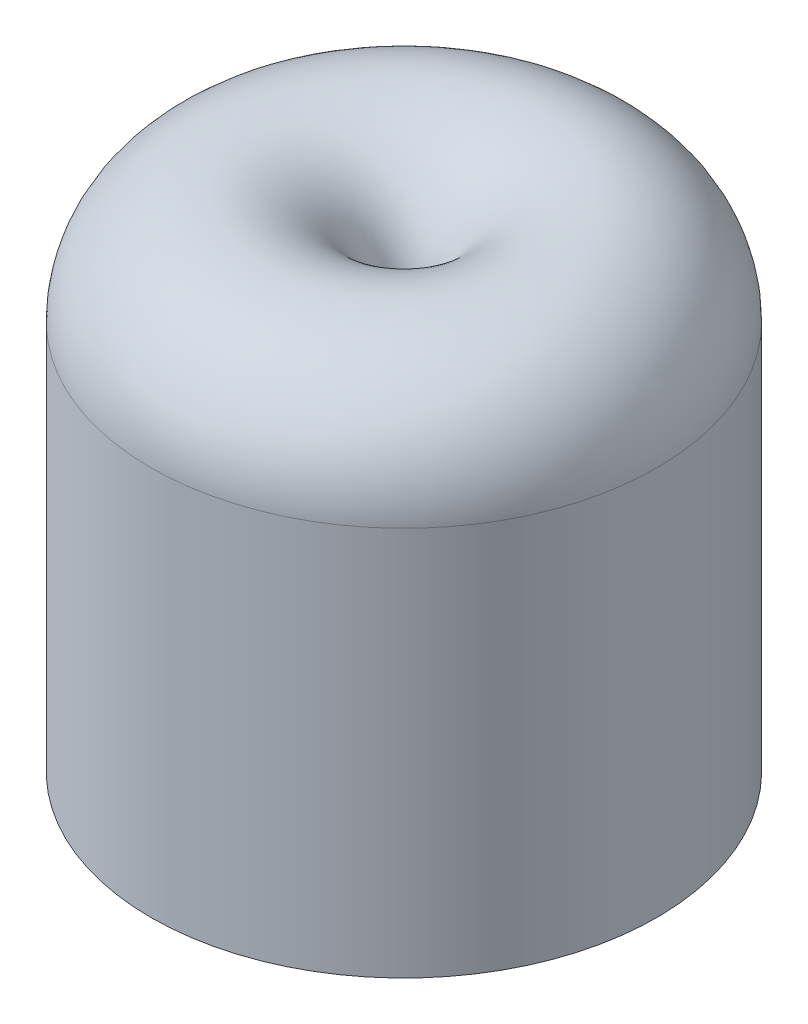
from build123d import *

# Parameters (mm, degrees)
SKETCH2_R           = 6.35
SKETCH2_R_2         = 0.508
BOSS_EXTRUDE1_DEPTH = 12.7
FILLET7_R           = 2.921


with BuildPart() as part:
    # Sketch2 → Boss-Extrude1 (new body)
    with BuildSketch(Plane(origin=(0, 0, 0), x_dir=(1, 0, 0), z_dir=(0, 1, 0))):
        with Locations(Location((0, 0, 0), (0, 0, 270))):
            Circle(SKETCH2_R)
        with Locations(Location((0, 0, 0), (0, 0, 270))):
            Circle(SKETCH2_R_2, mode=Mode.SUBTRACT)
    extrude(amount=BOSS_EXTRUDE1_DEPTH)

    # Fillet7
    fillet7_edges = [part.edges().sort_by_distance(p)[0] for p in [
        (0, 12.7, -6.35),
        (0, 12.7, -0.508),
    ]]
    fillet(fillet7_edges, radius=FILLET7_R - 0.0001)  # a hair under: the kernel refuses the full size


solid = part.part
